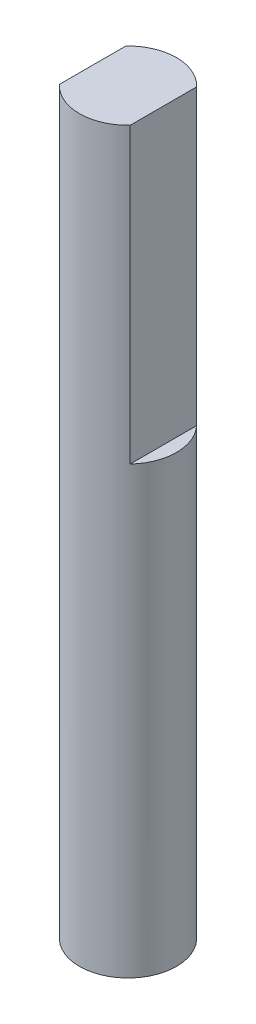
from build123d import *

# Parameters (mm, degrees)
CROQUIS2_R                   = 2.4
SALIENTE_EXTRUIR1_DEPTH      = 18.25
CORTAR_EXTRUIR_L_MINA1_DEPTH = 14.5


with BuildPart() as part:
    # Croquis2 → Saliente-Extruir1 (new, symmetric)
    with BuildSketch(Plane(origin=(0, 0, 0), x_dir=(1, 0, 0), z_dir=(0, 1, 0))):
        Circle(CROQUIS2_R)
    extrude(amount=SALIENTE_EXTRUIR1_DEPTH, both=True)

    # Croquis3 → Cortar-Extruir-Lámina1 (cut)
    with BuildSketch(Plane(origin=(0, 18.25, 0), x_dir=(1, 0, 0), z_dir=(0, 1, 0))):
        with BuildLine():
            Line((-11.75, 3.962007067), (-11.75, -3.962007067))
            ThreePointArc((-11.75, -3.962007067), (0, -12.4), (11.75, -3.962007067))
            Line((11.75, -3.962007067), (11.75, 3.962007067))
            ThreePointArc((11.75, 3.962007067), (0, 12.4), (-11.75, 3.962007067))
        make_face()
        with BuildLine():
            Line((-1.75, 1.642406771), (-1.75, -1.642406771))
            ThreePointArc((-1.75, -1.642406771), (0, -2.4), (1.75, -1.642406771))
            Line((1.75, -1.642406771), (1.75, 1.642406771))
            ThreePointArc((1.75, 1.642406771), (0, 2.4), (-1.75, 1.642406771))
        make_face(mode=Mode.SUBTRACT)
    extrude(amount=-CORTAR_EXTRUIR_L_MINA1_DEPTH, mode=Mode.SUBTRACT)


solid = part.part
